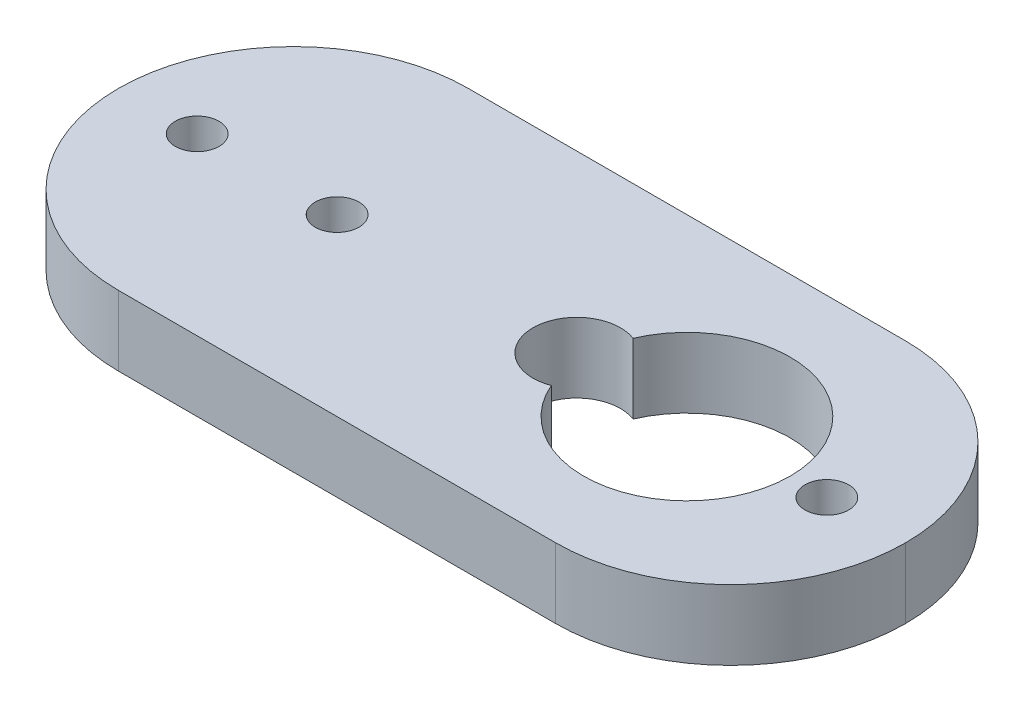
from build123d import *

# Parameters (mm, degrees)
SKETCH1_W           = 45
SKETCH1_H           = 20
BOSS_EXTRUDE1_DEPTH = 4
SKETCH2_R           = 1.25
CUT_EXTRUDE1_DEPTH  = 25.944939367
FILLET2_R           = 10


with BuildPart() as part:
    # Sketch1 → Boss-Extrude1 (new body)
    with BuildSketch(Plane(origin=(0, 0, 0), x_dir=(1, 0, 0), z_dir=(0, 1, 0))):
        Rectangle(SKETCH1_W, SKETCH1_H)
    extrude(amount=BOSS_EXTRUDE1_DEPTH)

    # Sketch2 → Cut-Extrude1 (cut, through all)
    with BuildSketch(Plane(origin=(0, 4, 0), x_dir=(1, 0, 0), z_dir=(0, 1, 0))):
        with Locations(Location((18, 0, 0), (0, 0, 270))):
            Circle(SKETCH2_R)
        with Locations(Location((-10, 0, 0), (0, 0, 270))):
            Circle(SKETCH2_R)
        with Locations(Location((-18, 0, 0), (0, 0, 270))):
            Circle(SKETCH2_R)
        with BuildLine():
            ThreePointArc((4.583333333, -2.338743727), (15.9, 0), (4.583333333, 2.338743727))
            ThreePointArc((4.583333333, 2.338743727), (1.2, 0), (4.583333333, -2.338743727))
        make_face()
    extrude(amount=-CUT_EXTRUDE1_DEPTH, mode=Mode.SUBTRACT)

    # Fillet2
    fillet2_edges = [part.edges().sort_by_distance(p)[0] for p in [
        (-22.5, 2, -10),
        (22.5, 2, -10),
        (-22.5, 2, 10),
        (22.5, 2, 10),
    ]]
    fillet(fillet2_edges, radius=FILLET2_R - 0.0001)  # a hair under: the kernel refuses the full size


solid = part.part
